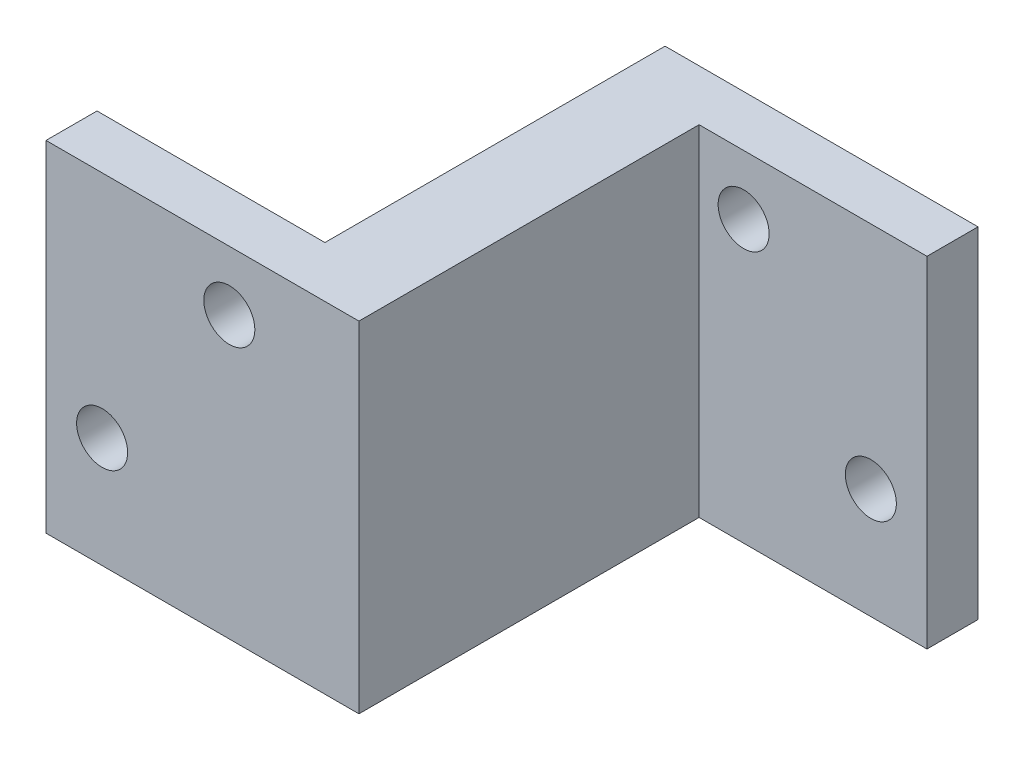
from build123d import *

# Parameters (mm, degrees)
BOSS_EXTRUDE1_DEPTH = 20
SKETCH2_R           = 1.5
CUT_EXTRUDE1_DEPTH  = 43.558665393


with BuildPart() as part:
    # Sketch1 → Boss-Extrude1 (new body)
    with BuildSketch(Plane(origin=(0, 0, 0), x_dir=(1, 0, 0), z_dir=(0, 1, 0))):
        Polygon((0, 0), (18.4, 0), (18.4, 20), (31.8, 20), (31.8, 23), (13.4, 23), (13.4, 3), (0, 3), align=None)
    extrude(amount=BOSS_EXTRUDE1_DEPTH)

    # Sketch2 → Cut-Extrude1 (cut, symmetric)
    with BuildSketch(Plane.XY.offset(-20)):
        with Locations((28.5, 6.5)):
            Circle(SKETCH2_R)
        with Locations((21.02, 16.5)):
            Circle(SKETCH2_R)
    cut_extrude1 = extrude(amount=CUT_EXTRUDE1_DEPTH, both=True, mode=Mode.SUBTRACT)

    # Mirror1: Cut-Extrude1 across plane
    add(cut_extrude1.mirror(Plane.ZY.offset(-15.9)), mode=Mode.SUBTRACT)


solid = part.part
